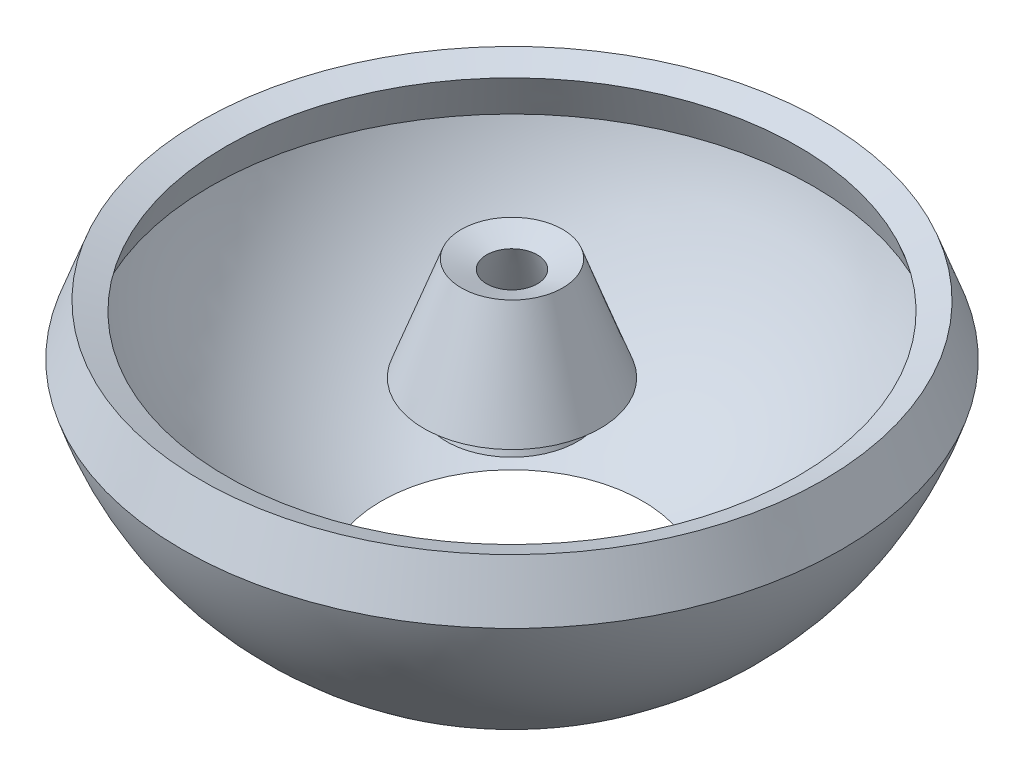
from build123d import *

# Parameters (mm, degrees)
CUT_EXTRUDE1_DEPTH      = 215.303743037
CUT_EXTRUDE1_DEPTH_BACK = 215.303743037
SKETCH5_W               = 175.98458714
SKETCH5_H               = 45.411582318


with BuildPart() as part:
    # Sketch2 → Revolve-Thin2 (revolve)
    with BuildSketch(Plane.XY):
        with BuildLine():
            ThreePointArc((0, -127.481606516), (56.725110393, -114.165764793), (101.6, -77))
            ThreePointArc((101.6, -77), (113.427377386, -58.187542131), (121.808321308, -37.607085239))
            Line((121.808321308, -37.607085239), (112.253349055, -34.657084351))
            ThreePointArc((112.253349055, -34.657084351), (104.52982891, -53.623154866), (93.630222808, -70.959912955))
            ThreePointArc((93.630222808, -70.959912955), (52.275440206, -105.210295223), (0, -117.481606516))
            Line((0, -117.481606516), (0, -127.481606516))
        make_face()
    revolve(axis=Axis((0, 0, 0), (0, -1, 0)))

    # Sketch2<8> → Revolve-Thin6 (revolve)
    with BuildSketch(Plane.XY):
        Polygon((121.808321308, -37.607085239), (114.967918441, -18.813232823), (105.570992234, -22.233434256), (112.4113951, -41.027286672), align=None)
    revolve(axis=Axis((0, 0, 0), (0, -1, 0)))

    # Sketch5 → Cut-Extrude1 (cut, two sides: drawn at the far end of the back side and taken through both)
    with BuildSketch(Plane.XY.offset(-CUT_EXTRUDE1_DEPTH_BACK)):
        with Locations((18.855074334, -129.811369521)):
            Rectangle(SKETCH5_W, SKETCH5_H)
    extrude(amount=CUT_EXTRUDE1_DEPTH + CUT_EXTRUDE1_DEPTH_BACK, mode=Mode.SUBTRACT)


with BuildPart() as body_2:
    # Sketch2<10> → Revolve-Thin7 (revolve)
    with BuildSketch(Plane.XY):
        Polygon((24.193611273, -51.852378668), (22.483510557, -47.153915564), (32.58520623, -43.477199023), (18.733390426, -5.419647882), (9.336464218, -8.839849315), (19.768078589, -37.500474249), (9.666382916, -41.17719079), (14.796685066, -55.272580101), align=None)
    revolve(axis=Axis((0, 0, 0), (0, -1, 0)))


solid = Compound([part.part, body_2.part])
